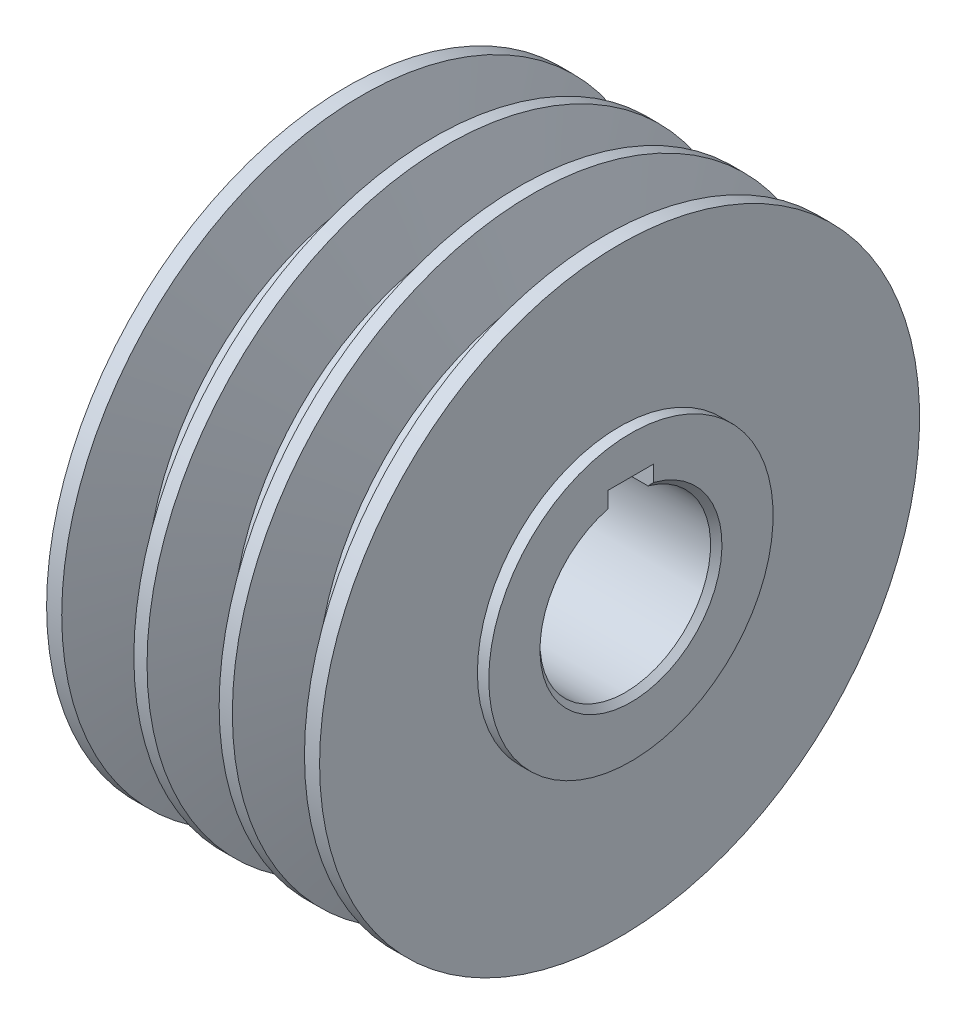
from build123d import *

# Parameters (mm, degrees)
PATTERN_LINEAR_1_COUNT = 3
PATTERN_LINEAR_1_PITCH = 15
CHAMFER_1_SIZE         = 1
SKETCH_4_W             = 8
SKETCH_4_H             = 3.843167705
CUT_EXTRUDE_1_DEPTH    = 90.806040999


with BuildPart() as part:
    # 草图1 → 旋转1 (revolve)
    with BuildSketch(Plane.XY):
        Polygon((0, 15), (0, 52.75), (48, 52.75), (48, 25), (50, 25), (50, 15), align=None)
    revolve(axis=Axis((0, 0, 0), (1, 0, 0)))

    # 草图2 → 切除-旋转1 (revolve, cut)
    with BuildSketch(Plane.XY):
        Polygon((11.840143071, 41.3), (15.340759374, 52.75), (2.659240626, 52.75), (6.159856929, 41.3), align=None)
    cut_revolve_1 = revolve(axis=Axis((0, 0, 0), (1, 0, 0)), mode=Mode.SUBTRACT)

    # 阵列(线性)1: 切除-旋转1 ×3
    with Locations(*[(i * PATTERN_LINEAR_1_PITCH, 0, 0) for i in range(1, PATTERN_LINEAR_1_COUNT)]):
        add(cut_revolve_1, mode=Mode.SUBTRACT)

    # 倒角1
    chamfer_1_edges = [part.edges().sort_by_distance(p)[0] for p in [
        (50, -15, 0),
        (0, -15, 0),
    ]]
    chamfer(chamfer_1_edges, length=CHAMFER_1_SIZE)

    # 草图4 → 切除-拉伸1 (cut, through all)
    with BuildSketch(Plane.ZY):
        with Locations((0, 16.378416148)):
            Rectangle(SKETCH_4_W, SKETCH_4_H)
    extrude(amount=-CUT_EXTRUDE_1_DEPTH, mode=Mode.SUBTRACT)


solid = part.part
